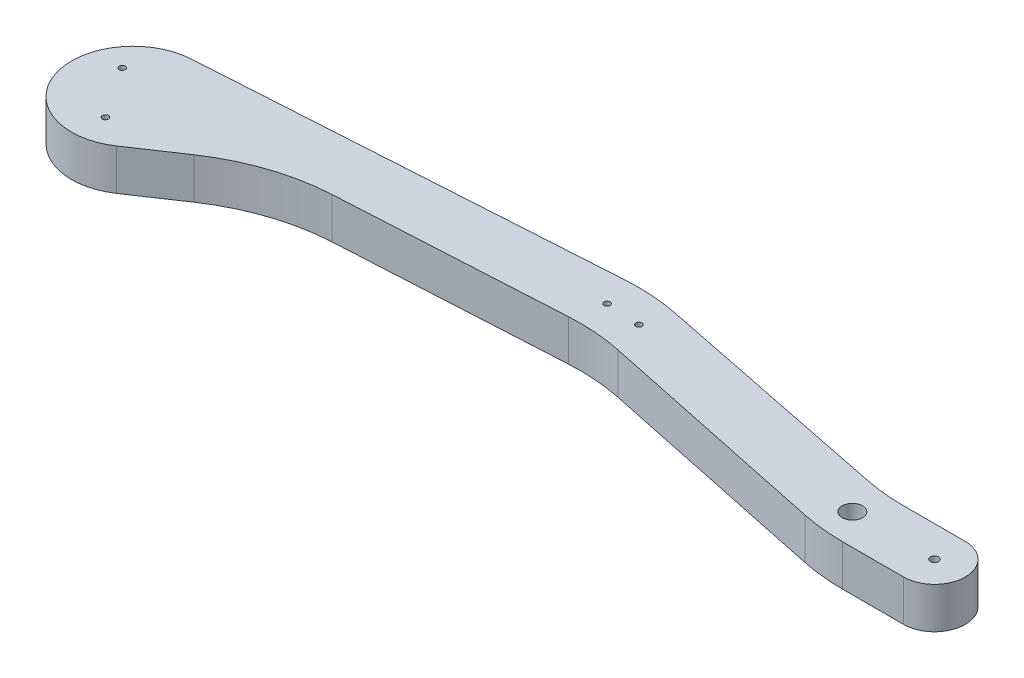
from build123d import *

# Parameters (mm, degrees)
BOSS_EXTRUDE1_DEPTH      = 10
BOSS_EXTRUDE1_DEPTH_BACK = 10
SKETCH1_R                = 5
SKETCH1_R_2              = 2
FILLET1_R                = 100
SKETCH2_R                = 1.5
CUT_EXTRUDE1_DEPTH       = 10


with BuildPart() as part:
    # Sketch1 → Boss-Extrude1 (new, two sides: drawn at the far end of the back side and taken through both)
    with BuildSketch(Plane(origin=(0, 0, 0), x_dir=(1, 0, 0), z_dir=(0, 1, 0)).offset(-BOSS_EXTRUDE1_DEPTH_BACK)):
        with BuildLine():
            Line((-138.053278996, 13.889014505), (-5.919683, -13.782501703))
            Line((-5.919683, -13.782501703), (0, -15))
            Line((0, -15), (40, -15))
            ThreePointArc((40, -15), (55, 0), (40, 15))
            Line((40, 15), (0, 15))
            Line((0, 15), (-139.784941349, 43.225909045))
            Line((-139.784941349, 43.225909045), (-351.875415017, 29.941322925))
            ThreePointArc((-351.875415017, 29.941322925), (-378.412739548, -9.628926804), (-333.285739517, -24.912516864))
            Line((-333.285739517, -24.912516864), (-287.823465989, 5.588948968))
            Line((-287.823465989, 5.588948968), (-138.053278996, 13.889014505))
        make_face()
        Circle(SKETCH1_R, mode=Mode.SUBTRACT)
        with Locations((40, 0)):
            Circle(SKETCH1_R_2, mode=Mode.SUBTRACT)
    extrude(amount=BOSS_EXTRUDE1_DEPTH + BOSS_EXTRUDE1_DEPTH_BACK)

    # Fillet1
    fillet1_edges = [part.edges().sort_by_distance(p)[0] for p in [
        (0, 0, -15),
        (-139.784941349, 0, -43.225909045),
        (-138.053278996, 0, -13.889014505),
        (-287.823465989, 0, -5.588948968),
        (0, 0, 15),
    ]]
    fillet(fillet1_edges, radius=FILLET1_R)

    # Sketch2 → Cut-Extrude1 (cut)
    with BuildSketch(Plane(origin=(0, 10, 0), x_dir=(1, 0, 0), z_dir=(0, 1, 0))):
        with Locations((-147.336246923, 28.050603479)):
            Circle(SKETCH2_R)
        with Locations((-130.791911053, 26.905656844)):
            Circle(SKETCH2_R)
        with Locations((-364.746711272, 9.415773639)):
            Circle(SKETCH2_R)
        with Locations((-348.032450789, -15.496743225)):
            Circle(SKETCH2_R)
    extrude(amount=-CUT_EXTRUDE1_DEPTH, mode=Mode.SUBTRACT)


solid = part.part
